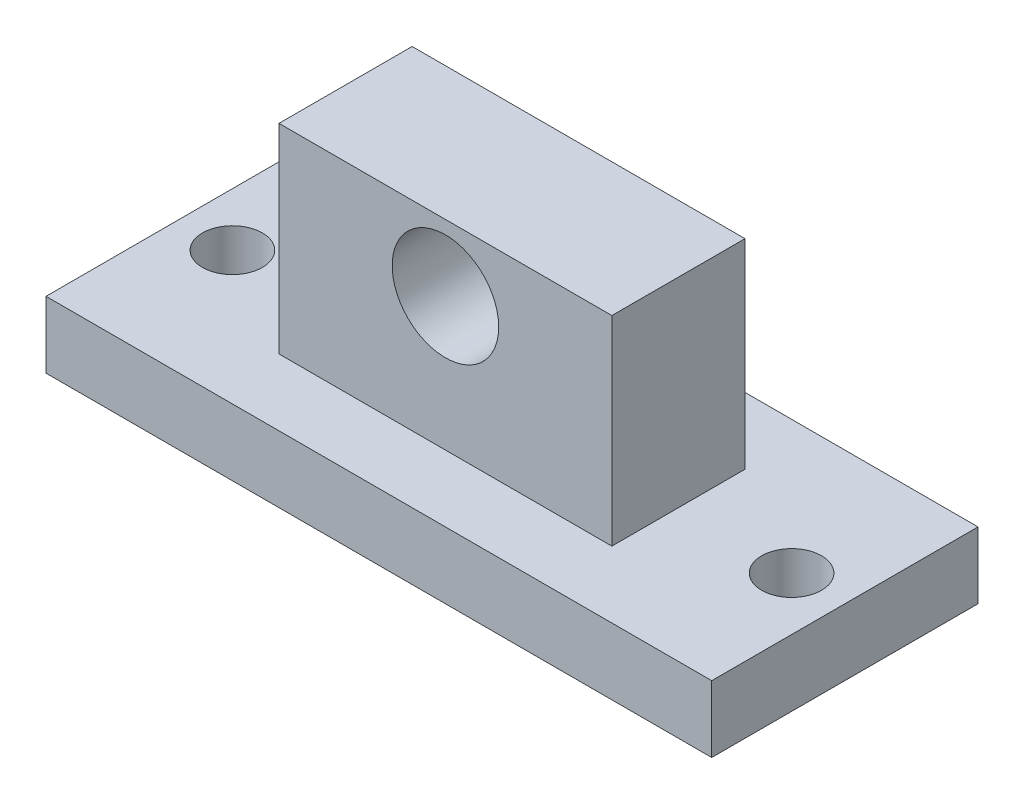
from build123d import *

# Parameters (mm, degrees)
SKETCH1_W           = 50
SKETCH1_H           = 20
BOSS_EXTRUDE1_DEPTH = 5
SKETCH2_R           = 2.25
CUT_EXTRUDE1_DEPTH  = 5
SKETCH3_W           = 25
SKETCH3_H           = 10
BOSS_EXTRUDE2_DEPTH = 15
SKETCH4_R           = 4
CUT_EXTRUDE2_DEPTH  = 15


with BuildPart() as part:
    # Sketch1 → Boss-Extrude1 (new body)
    with BuildSketch(Plane(origin=(0, 0, 0), x_dir=(1, 0, 0), z_dir=(0, 1, 0))):
        Rectangle(SKETCH1_W, SKETCH1_H)
    extrude(amount=BOSS_EXTRUDE1_DEPTH)

    # Sketch2 → Cut-Extrude1 (cut)
    with BuildSketch(Plane(origin=(0, 5, 0), x_dir=(1, 0, 0), z_dir=(0, 1, 0))):
        with Locations((-21, 0)):
            Circle(SKETCH2_R)
        with Locations((21, 0)):
            Circle(SKETCH2_R)
    extrude(amount=-CUT_EXTRUDE1_DEPTH, mode=Mode.SUBTRACT)

    # Sketch3 → Boss-Extrude2 (add)
    with BuildSketch(Plane(origin=(0, 5, 0), x_dir=(1, 0, 0), z_dir=(0, 1, 0))):
        Rectangle(SKETCH3_W, SKETCH3_H)
    extrude(amount=BOSS_EXTRUDE2_DEPTH)

    # Sketch4 → Cut-Extrude2 (cut)
    with BuildSketch(Plane.XY.offset(5)):
        with Locations((0, 15)):
            Circle(SKETCH4_R)
    extrude(amount=-CUT_EXTRUDE2_DEPTH, mode=Mode.SUBTRACT)


solid = part.part
